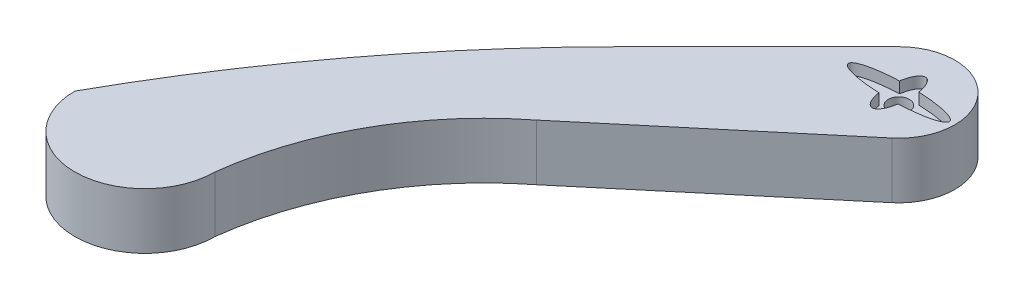
from build123d import *

# Parameters (mm, degrees)
EXTRUDE_1_DEPTH          = 10
CUT_EXTRUDE_2_DEPTH      = 228.188324068
CUT_EXTRUDE_2_DEPTH_BACK = 228.188324068
SKETCH_2_R               = 3.75
CUT_EXTRUDE_3_DEPTH      = 4
CUT_EXTRUDE_3_DEPTH_BACK = 4


with BuildPart() as part:
    # 草图1 → 凸台-拉伸1 (new, symmetric)
    with BuildSketch(Plane(origin=(0, 0, 0), x_dir=(1, 0, 0), z_dir=(0, 1, 0))):
        with BuildLine():
            Line((-14.142135624, 14.142135624), (-63.639610307, -35.355339059))
            ThreePointArc((-63.639610307, -35.355339059), (-109.455133557, -88.069120133), (-147.47848225, -146.652648876))
            ThreePointArc((-147.47848225, -146.652648876), (-122.47848225, -171.652648876), (-97.47848225, -146.652648876))
            ThreePointArc((-97.47848225, -146.652648876), (-84.10519624, -105.787977439), (-56.088247687, -73.171773734))
            Line((-56.088247687, -73.171773734), (12.855752194, -15.320888862))
            ThreePointArc((12.855752194, -15.320888862), (14.745546736, 13.511804152), (-14.142135624, 14.142135624))
        make_face()
    extrude(amount=EXTRUDE_1_DEPTH, both=True)

    # 草图2 → 切除-拉伸2 (cut, two sides: drawn at the far end of the back side and taken through both)
    with BuildSketch(Plane(origin=(0, 10, 0), x_dir=(-1, 0, 0), z_dir=(0, -1, 0)).offset(-CUT_EXTRUDE_2_DEPTH_BACK)):
        Circle(SKETCH_2_R)
    extrude(amount=CUT_EXTRUDE_2_DEPTH + CUT_EXTRUDE_2_DEPTH_BACK, mode=Mode.SUBTRACT)

    # 草图3 → 切除-拉伸3 (cut, two sides: drawn at the far end of the back side and taken through both)
    with BuildSketch(Plane(origin=(0, 10, 0), x_dir=(-1, 0, 0), z_dir=(0, -1, 0)).offset(-CUT_EXTRUDE_3_DEPTH_BACK)):
        with BuildLine():
            add(Edge.make_bspline(
                [(-3.457188478, 3.680182522), (-18, 3.087230439), (-18, 0), (-18, -3.087230439), (-3.457188478, -3.680182522)],
                knots=[1.764063263, 1.764063263, 1.764063263, 3.141592654, 3.141592654, 4.519122044, 4.519122044, 4.519122044], degree=2, weights=[1, 0.772031744, 1, 0.772031744, 1]))
            add(Edge.make_bspline(
                [(-3.457188478, -3.680182522), (0, -24.523240209), (3.457188478, -3.680182522)],
                knots=[1.968592603, 1.968592603, 1.968592603, 4.314592705, 4.314592705, 4.314592705], degree=2, weights=[1, 0.387387634, 1]))
            add(Edge.make_bspline(
                [(3.457188478, -3.680182522), (18, -3.087230439), (18, 0), (18, 3.087230439), (3.457188478, 3.680182522)],
                knots=[4.905655917, 4.905655917, 4.905655917, 6.283185307, 6.283185307, 7.660714698, 7.660714698, 7.660714698], degree=2, weights=[1, 0.772031744, 1, 0.772031744, 1]))
            add(Edge.make_bspline(
                [(3.457188478, 3.680182522), (0, 24.523240209), (-3.457188478, 3.680182522)],
                knots=[5.110185256, 5.110185256, 5.110185256, 7.456185358, 7.456185358, 7.456185358], degree=2, weights=[1, 0.387387634, 1]))
        make_face()
    extrude(amount=CUT_EXTRUDE_3_DEPTH + CUT_EXTRUDE_3_DEPTH_BACK, mode=Mode.SUBTRACT)


solid = part.part
